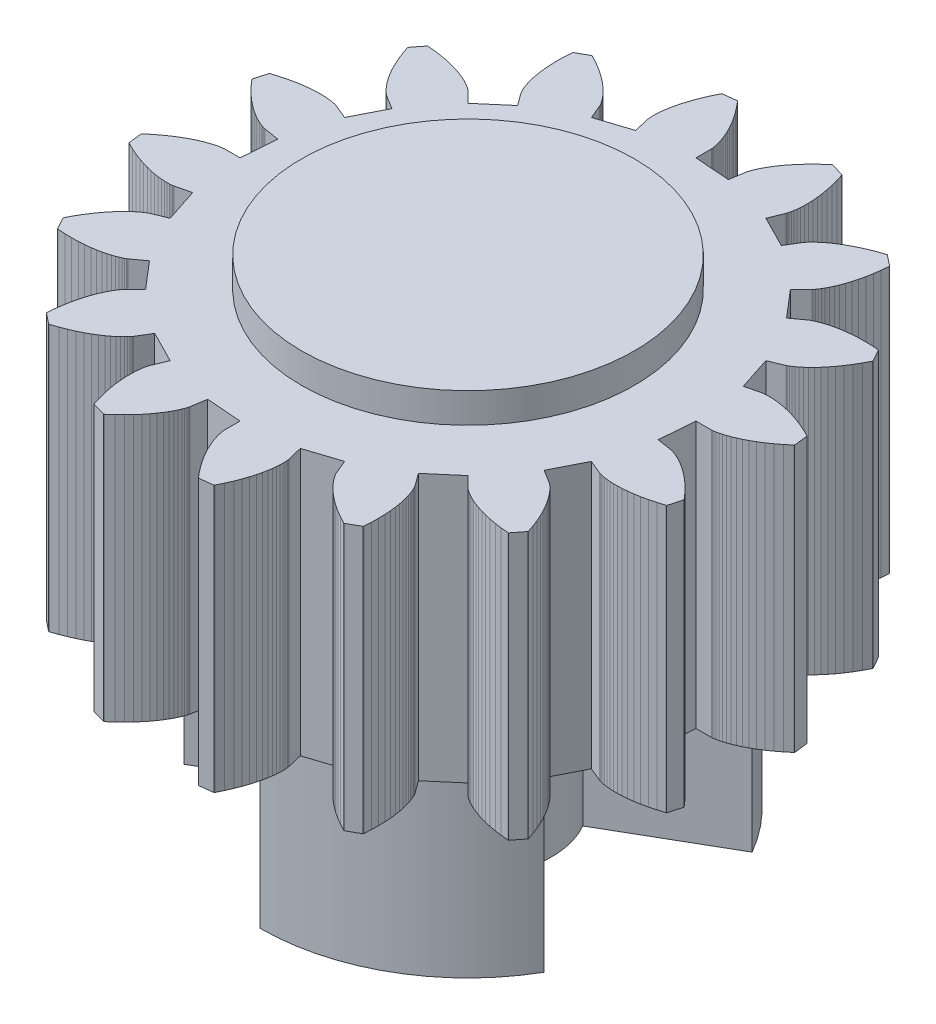
from build123d import *

# Parameters (mm, degrees)
BOSS_EXTRUDE1_DEPTH     = 8
CUT_EXTRUDE1_DEPTH      = 15.984044596
CUT_EXTRUDE1_DEPTH_BACK = 15.984044596
SKETCH2_R               = 2.525
SKETCH3_R               = 6.25
SKETCH3_R_2             = 2.525
BOSS_EXTRUDE2_DEPTH     = 5.5
SKETCH4_R               = 5
SKETCH4_R_2             = 2.5
BOSS_EXTRUDE3_DEPTH     = 0.9
CUT_EXTRUDE2_START      = -5.5
CUT_EXTRUDE2_DEPTH      = 5.5
BOSS_EXTRUDE4_START     = -14.4
SKETCH6_R               = 2.5
BOSS_EXTRUDE4_DEPTH     = 14.4
BOSS_EXTRUDE5_START     = -14.4
SKETCH7_R               = 2.525
BOSS_EXTRUDE5_DEPTH     = 14.4


with BuildPart() as part:
    # Sketch1 → Boss-Extrude1 (new body)
    with BuildSketch(Plane(origin=(0, 0, 0), x_dir=(1, 0, 0), z_dir=(0, 1, 0))):
        Polygon((6.85, 0), (7.309477, 1.3e-05), (7.321987, 0.000555), (7.348326, 0.002795), (7.388345, 0.007937), (7.441814, 0.017175), (7.508424, 0.03169), (7.587793, 0.052638), (7.679459, 0.081154), (7.782889, 0.118343), (7.897476, 0.165276), (8.022541, 0.222988), (8.157339, 0.29247), (8.301057, 0.37467), (8.452819, 0.470485), (8.611689, 0.580758), (8.776672, 0.706278), (8.94672, 0.847771), (8.957492, 0.857161), (8.958839, 0.858339), (8.908582, 1.279521), (8.906822, 1.280587), (8.894139, 1.28717), (8.695507, 1.384544), (8.505565, 1.467592), (8.325162, 1.537266), (8.155077, 1.594567), (7.996022, 1.640535), (7.848635, 1.676249), (7.713484, 1.702822), (7.591059, 1.721393), (7.481775, 1.733127), (7.385968, 1.739209), (7.303897, 1.740839), (7.235743, 1.739226), (7.181604, 1.735588), (7.141502, 1.731143), (7.115378, 1.727104), (7.103093, 1.724679), (6.656587, 1.616277), (6.328575, 2.621382), (6.753071, 2.797228), (6.764421, 2.802516), (6.787899, 2.814665), (6.822904, 2.83473), (6.868766, 2.863727), (6.924752, 2.902627), (6.990063, 2.952354), (7.063839, 3.013779), (7.145164, 3.087718), (7.233068, 3.174929), (7.326528, 3.276108), (7.424475, 3.391886), (7.525796, 3.522827), (7.62934, 3.669425), (7.733916, 3.832101), (7.838307, 4.011203), (7.941264, 4.207), (7.947622, 4.219797), (7.948416, 4.221401), (7.740805, 4.59129), (7.738771, 4.591601), (7.724535, 4.592829), (7.503759, 4.606779), (7.296494, 4.610817), (7.10316, 4.60615), (6.924094, 4.594), (6.759555, 4.575601), (6.609721, 4.552195), (6.474689, 4.525025), (6.354476, 4.495332), (6.249019, 4.464352), (6.158178, 4.433307), (6.081731, 4.403406), (6.019382, 4.375835), (5.970756, 4.351756), (5.935408, 4.332302), (5.912818, 4.318573), (5.902396, 4.311632), (5.531362, 4.040611), (4.843681, 4.843681), (5.168571, 5.16859), (5.177034, 5.177819), (5.194075, 5.198027), (5.218737, 5.229961), (5.250012, 5.274302), (5.28685, 5.331666), (5.328159, 5.402601), (5.372813, 5.487583), (5.419653, 5.587015), (5.467491, 5.701227), (5.515117, 5.83047), (5.561302, 5.974917), (5.604802, 6.134665), (5.644363, 6.309728), (5.678725, 6.500042), (5.70663, 6.705458), (5.726822, 6.925752), (5.727799, 6.940007), (5.727919, 6.941793), (5.394561, 7.204076), (5.392562, 7.203586), (5.37894, 7.199273), (5.169631, 7.127673), (4.976599, 7.052087), (4.799767, 6.973789), (4.638981, 6.894039), (4.494008, 6.814074), (4.364536, 6.735111), (4.25018, 6.658334), (4.150481, 6.584898), (4.064908, 6.51592), (3.992861, 6.452475), (3.933677, 6.395594), (3.886624, 6.346262), (3.850915, 6.305407), (3.825702, 6.273907), (3.810085, 6.252579), (3.803113, 6.242178), (3.564037, 5.849798), (2.621382, 6.328575), (2.797204, 6.753081), (2.80149, 6.764846), (2.809501, 6.790038), (2.820065, 6.828978), (2.831991, 6.881912), (2.844072, 6.949007), (2.855091, 7.03035), (2.863825, 7.125952), (2.869048, 7.23574), (2.869538, 7.359565), (2.864079, 7.497195), (2.851471, 7.648322), (2.830527, 7.812556), (2.800083, 7.989433), (2.759, 8.17841), (2.706171, 8.378869), (2.640523, 8.59012), (2.63597, 8.603664), (2.635398, 8.60536), (2.227044, 8.720108), (2.225385, 8.71889), (2.21445, 8.709692), (2.048474, 8.563443), (1.899061, 8.419741), (1.765653, 8.279733), (1.647625, 8.144523), (1.544288, 8.015166), (1.45489, 7.892666), (1.37862, 7.777972), (1.314613, 7.671973), (1.261951, 7.575498), (1.219668, 7.489311), (1.186755, 7.414112), (1.162163, 7.350528), (1.144806, 7.299118), (1.133567, 7.260367), (1.127301, 7.234686), (1.12484, 7.222408), (1.054121, 6.768407), (0, 6.85), (-1.3e-05, 7.309477), (-0.000555, 7.321987), (-0.002795, 7.348326), (-0.007937, 7.388345), (-0.017175, 7.441814), (-0.03169, 7.508424), (-0.052638, 7.587793), (-0.081154, 7.679459), (-0.118343, 7.782889), (-0.165276, 7.897476), (-0.222988, 8.022541), (-0.29247, 8.157339), (-0.37467, 8.301057), (-0.470485, 8.452819), (-0.580758, 8.611689), (-0.706278, 8.776672), (-0.847771, 8.94672), (-0.857161, 8.957492), (-0.858339, 8.958839), (-1.279521, 8.908582), (-1.280587, 8.906822), (-1.28717, 8.894139), (-1.384544, 8.695507), (-1.467592, 8.505565), (-1.537266, 8.325162), (-1.594567, 8.155077), (-1.640535, 7.996022), (-1.676249, 7.848635), (-1.702822, 7.713484), (-1.721393, 7.591059), (-1.733127, 7.481775), (-1.739209, 7.385968), (-1.740839, 7.303897), (-1.739226, 7.235743), (-1.735588, 7.181604), (-1.731143, 7.141502), (-1.727104, 7.115378), (-1.724679, 7.103093), (-1.616277, 6.656587), (-2.621382, 6.328575), (-2.797228, 6.753071), (-2.802516, 6.764421), (-2.814665, 6.787899), (-2.83473, 6.822904), (-2.863727, 6.868766), (-2.902627, 6.924752), (-2.952354, 6.990063), (-3.013779, 7.063839), (-3.087718, 7.145164), (-3.174929, 7.233068), (-3.276108, 7.326528), (-3.391886, 7.424475), (-3.522827, 7.525796), (-3.669425, 7.62934), (-3.832101, 7.733916), (-4.011203, 7.838307), (-4.207, 7.941264), (-4.219797, 7.947622), (-4.221401, 7.948416), (-4.59129, 7.740805), (-4.591601, 7.738771), (-4.592829, 7.724535), (-4.606779, 7.503759), (-4.610817, 7.296494), (-4.60615, 7.10316), (-4.594, 6.924094), (-4.575601, 6.759555), (-4.552195, 6.609721), (-4.525025, 6.474689), (-4.495332, 6.354476), (-4.464352, 6.249019), (-4.433307, 6.158178), (-4.403406, 6.081731), (-4.375835, 6.019382), (-4.351756, 5.970756), (-4.332302, 5.935408), (-4.318573, 5.912818), (-4.311632, 5.902396), (-4.040611, 5.531362), (-4.843681, 4.843681), (-5.16859, 5.168571), (-5.177819, 5.177034), (-5.198027, 5.194075), (-5.229961, 5.218737), (-5.274302, 5.250012), (-5.331666, 5.28685), (-5.402601, 5.328159), (-5.487583, 5.372813), (-5.587015, 5.419653), (-5.701227, 5.467491), (-5.83047, 5.515117), (-5.974917, 5.561302), (-6.134665, 5.604802), (-6.309728, 5.644363), (-6.500042, 5.678725), (-6.705458, 5.70663), (-6.925752, 5.726822), (-6.940007, 5.727799), (-6.941793, 5.727919), (-7.204076, 5.394561), (-7.203586, 5.392562), (-7.199273, 5.37894), (-7.127673, 5.169631), (-7.052087, 4.976599), (-6.973789, 4.799767), (-6.894039, 4.638981), (-6.814074, 4.494008), (-6.735111, 4.364536), (-6.658334, 4.25018), (-6.584898, 4.150481), (-6.51592, 4.064908), (-6.452475, 3.992861), (-6.395594, 3.933677), (-6.346262, 3.886624), (-6.305407, 3.850915), (-6.273907, 3.825702), (-6.252579, 3.810085), (-6.242178, 3.803113), (-5.849798, 3.564037), (-6.328575, 2.621382), (-6.753081, 2.797204), (-6.764846, 2.80149), (-6.790038, 2.809501), (-6.828978, 2.820065), (-6.881912, 2.831991), (-6.949007, 2.844072), (-7.03035, 2.855091), (-7.125952, 2.863825), (-7.23574, 2.869048), (-7.359565, 2.869538), (-7.497195, 2.864079), (-7.648322, 2.851471), (-7.812556, 2.830527), (-7.989433, 2.800083), (-8.17841, 2.759), (-8.378869, 2.706171), (-8.59012, 2.640523), (-8.603664, 2.63597), (-8.60536, 2.635398), (-8.720108, 2.227044), (-8.71889, 2.225385), (-8.709692, 2.21445), (-8.563443, 2.048474), (-8.419741, 1.899061), (-8.279733, 1.765653), (-8.144523, 1.647625), (-8.015166, 1.544288), (-7.892666, 1.45489), (-7.777972, 1.37862), (-7.671973, 1.314613), (-7.575498, 1.261951), (-7.489311, 1.219668), (-7.414112, 1.186755), (-7.350528, 1.162163), (-7.299118, 1.144806), (-7.260367, 1.133567), (-7.234686, 1.127301), (-7.222408, 1.12484), (-6.768407, 1.054121), (-6.85, 0), (-7.309477, -1.3e-05), (-7.321987, -0.000555), (-7.348326, -0.002795), (-7.388345, -0.007937), (-7.441814, -0.017175), (-7.508424, -0.03169), (-7.587793, -0.052638), (-7.679459, -0.081154), (-7.782889, -0.118343), (-7.897476, -0.165276), (-8.022541, -0.222988), (-8.157339, -0.29247), (-8.301057, -0.37467), (-8.452819, -0.470485), (-8.611689, -0.580758), (-8.776672, -0.706278), (-8.94672, -0.847771), (-8.957492, -0.857161), (-8.958839, -0.858339), (-8.908582, -1.279521), (-8.906822, -1.280587), (-8.894139, -1.28717), (-8.695507, -1.384544), (-8.505565, -1.467592), (-8.325162, -1.537266), (-8.155077, -1.594567), (-7.996022, -1.640535), (-7.848635, -1.676249), (-7.713484, -1.702822), (-7.591059, -1.721393), (-7.481775, -1.733127), (-7.385968, -1.739209), (-7.303897, -1.740839), (-7.235743, -1.739226), (-7.181604, -1.735588), (-7.141502, -1.731143), (-7.115378, -1.727104), (-7.103093, -1.724679), (-6.656587, -1.616277), (-6.328575, -2.621382), (-6.753071, -2.797228), (-6.764421, -2.802516), (-6.787899, -2.814665), (-6.822904, -2.83473), (-6.868766, -2.863727), (-6.924752, -2.902627), (-6.990063, -2.952354), (-7.063839, -3.013779), (-7.145164, -3.087718), (-7.233068, -3.174929), (-7.326528, -3.276108), (-7.424475, -3.391886), (-7.525796, -3.522827), (-7.62934, -3.669425), (-7.733916, -3.832101), (-7.838307, -4.011203), (-7.941264, -4.207), (-7.947622, -4.219797), (-7.948416, -4.221401), (-7.740805, -4.59129), (-7.738771, -4.591601), (-7.724535, -4.592829), (-7.503759, -4.606779), (-7.296494, -4.610817), (-7.10316, -4.60615), (-6.924094, -4.594), (-6.759555, -4.575601), (-6.609721, -4.552195), (-6.474689, -4.525025), (-6.354476, -4.495332), (-6.249019, -4.464352), (-6.158178, -4.433307), (-6.081731, -4.403406), (-6.019382, -4.375835), (-5.970756, -4.351756), (-5.935408, -4.332302), (-5.912818, -4.318573), (-5.902396, -4.311632), (-5.531362, -4.040611), (-4.843681, -4.843681), (-5.168571, -5.16859), (-5.177034, -5.177819), (-5.194075, -5.198027), (-5.218737, -5.229961), (-5.250012, -5.274302), (-5.28685, -5.331666), (-5.328159, -5.402601), (-5.372813, -5.487583), (-5.419653, -5.587015), (-5.467491, -5.701227), (-5.515117, -5.83047), (-5.561302, -5.974917), (-5.604802, -6.134665), (-5.644363, -6.309728), (-5.678725, -6.500042), (-5.70663, -6.705458), (-5.726822, -6.925752), (-5.727799, -6.940007), (-5.727919, -6.941793), (-5.394561, -7.204076), (-5.392562, -7.203586), (-5.37894, -7.199273), (-5.169631, -7.127673), (-4.976599, -7.052087), (-4.799767, -6.973789), (-4.638981, -6.894039), (-4.494008, -6.814074), (-4.364536, -6.735111), (-4.25018, -6.658334), (-4.150481, -6.584898), (-4.064908, -6.51592), (-3.992861, -6.452475), (-3.933677, -6.395594), (-3.886624, -6.346262), (-3.850915, -6.305407), (-3.825702, -6.273907), (-3.810085, -6.252579), (-3.803113, -6.242178), (-3.564037, -5.849798), (-2.621382, -6.328575), (-2.797204, -6.753081), (-2.80149, -6.764846), (-2.809501, -6.790038), (-2.820065, -6.828978), (-2.831991, -6.881912), (-2.844072, -6.949007), (-2.855091, -7.03035), (-2.863825, -7.125952), (-2.869048, -7.23574), (-2.869538, -7.359565), (-2.864079, -7.497195), (-2.851471, -7.648322), (-2.830527, -7.812556), (-2.800083, -7.989433), (-2.759, -8.17841), (-2.706171, -8.378869), (-2.640523, -8.59012), (-2.63597, -8.603664), (-2.635398, -8.60536), (-2.227044, -8.720108), (-2.225385, -8.71889), (-2.21445, -8.709692), (-2.048474, -8.563443), (-1.899061, -8.419741), (-1.765653, -8.279733), (-1.647625, -8.144523), (-1.544288, -8.015166), (-1.45489, -7.892666), (-1.37862, -7.777972), (-1.314613, -7.671973), (-1.261951, -7.575498), (-1.219668, -7.489311), (-1.186755, -7.414112), (-1.162163, -7.350528), (-1.144806, -7.299118), (-1.133567, -7.260367), (-1.127301, -7.234686), (-1.12484, -7.222408), (-1.054121, -6.768407), (0, -6.85), (1.3e-05, -7.309477), (0.000555, -7.321987), (0.002795, -7.348326), (0.007937, -7.388345), (0.017175, -7.441814), (0.03169, -7.508424), (0.052638, -7.587793), (0.081154, -7.679459), (0.118343, -7.782889), (0.165276, -7.897476), (0.222988, -8.022541), (0.29247, -8.157339), (0.37467, -8.301057), (0.470485, -8.452819), (0.580758, -8.611689), (0.706278, -8.776672), (0.847771, -8.94672), (0.857161, -8.957492), (0.858339, -8.958839), (1.279521, -8.908582), (1.280587, -8.906822), (1.28717, -8.894139), (1.384544, -8.695507), (1.467592, -8.505565), (1.537266, -8.325162), (1.594567, -8.155077), (1.640535, -7.996022), (1.676249, -7.848635), (1.702822, -7.713484), (1.721393, -7.591059), (1.733127, -7.481775), (1.739209, -7.385968), (1.740839, -7.303897), (1.739226, -7.235743), (1.735588, -7.181604), (1.731143, -7.141502), (1.727104, -7.115378), (1.724679, -7.103093), (1.616277, -6.656587), (2.621382, -6.328575), (2.797228, -6.753071), (2.802516, -6.764421), (2.814665, -6.787899), (2.83473, -6.822904), (2.863727, -6.868766), (2.902627, -6.924752), (2.952354, -6.990063), (3.013779, -7.063839), (3.087718, -7.145164), (3.174929, -7.233068), (3.276108, -7.326528), (3.391886, -7.424475), (3.522827, -7.525796), (3.669425, -7.62934), (3.832101, -7.733916), (4.011203, -7.838307), (4.207, -7.941264), (4.219797, -7.947622), (4.221401, -7.948416), (4.59129, -7.740805), (4.591601, -7.738771), (4.592829, -7.724535), (4.606779, -7.503759), (4.610817, -7.296494), (4.60615, -7.10316), (4.594, -6.924094), (4.575601, -6.759555), (4.552195, -6.609721), (4.525025, -6.474689), (4.495332, -6.354476), (4.464352, -6.249019), (4.433307, -6.158178), (4.403406, -6.081731), (4.375835, -6.019382), (4.351756, -5.970756), (4.332302, -5.935408), (4.318573, -5.912818), (4.311632, -5.902396), (4.040611, -5.531362), (4.843681, -4.843681), (5.16859, -5.168571), (5.177819, -5.177034), (5.198027, -5.194075), (5.229961, -5.218737), (5.274302, -5.250012), (5.331666, -5.28685), (5.402601, -5.328159), (5.487583, -5.372813), (5.587015, -5.419653), (5.701227, -5.467491), (5.83047, -5.515117), (5.974917, -5.561302), (6.134665, -5.604802), (6.309728, -5.644363), (6.500042, -5.678725), (6.705458, -5.70663), (6.925752, -5.726822), (6.940007, -5.727799), (6.941793, -5.727919), (7.204076, -5.394561), (7.203586, -5.392562), (7.199273, -5.37894), (7.127673, -5.169631), (7.052087, -4.976599), (6.973789, -4.799767), (6.894039, -4.638981), (6.814074, -4.494008), (6.735111, -4.364536), (6.658334, -4.25018), (6.584898, -4.150481), (6.51592, -4.064908), (6.452475, -3.992861), (6.395594, -3.933677), (6.346262, -3.886624), (6.305407, -3.850915), (6.273907, -3.825702), (6.252579, -3.810085), (6.242178, -3.803113), (5.849798, -3.564037), (6.328575, -2.621382), (6.753081, -2.797204), (6.764846, -2.80149), (6.790038, -2.809501), (6.828978, -2.820065), (6.881912, -2.831991), (6.949007, -2.844072), (7.03035, -2.855091), (7.125952, -2.863825), (7.23574, -2.869048), (7.359565, -2.869538), (7.497195, -2.864079), (7.648322, -2.851471), (7.812556, -2.830527), (7.989433, -2.800083), (8.17841, -2.759), (8.378869, -2.706171), (8.59012, -2.640523), (8.603664, -2.63597), (8.60536, -2.635398), (8.720108, -2.227044), (8.71889, -2.225385), (8.709692, -2.21445), (8.563443, -2.048474), (8.419741, -1.899061), (8.279733, -1.765653), (8.144523, -1.647625), (8.015166, -1.544288), (7.892666, -1.45489), (7.777972, -1.37862), (7.671973, -1.314613), (7.575498, -1.261951), (7.489311, -1.219668), (7.414112, -1.186755), (7.350528, -1.162163), (7.299118, -1.144806), (7.260367, -1.133567), (7.234686, -1.127301), (7.222408, -1.12484), (6.768407, -1.054121), align=None)
    extrude(amount=BOSS_EXTRUDE1_DEPTH)

    # Sketch2 → Cut-Extrude1 (cut, two sides: drawn at the far end of the back side and taken through both)
    with BuildSketch(Plane(origin=(0, 8, 0), x_dir=(1, 0, 0), z_dir=(0, 1, 0)).offset(-CUT_EXTRUDE1_DEPTH_BACK)):
        with Locations(Location((0, 0, 0), (0, 0, 270))):
            Circle(SKETCH2_R)
    extrude(amount=CUT_EXTRUDE1_DEPTH + CUT_EXTRUDE1_DEPTH_BACK, mode=Mode.SUBTRACT)

    # Sketch3 → Boss-Extrude2 (add)
    with BuildSketch(Plane.XZ):
        with Locations(Location((0, 0, 0), (0, 0, 90))):
            Circle(SKETCH3_R)
        with Locations(Location((0, 0, 0), (0, 0, 90))):
            Circle(SKETCH3_R_2, mode=Mode.SUBTRACT)
    extrude(amount=BOSS_EXTRUDE2_DEPTH)

    # Sketch4 → Boss-Extrude3 (add)
    with BuildSketch(Plane(origin=(0, 8, 0), x_dir=(1, 0, 0), z_dir=(0, 1, 0))):
        with Locations(Location((0, 0, 0), (0, 0, 270))):
            Circle(SKETCH4_R)
        with Locations(Location((0, 0, 0), (0, 0, 270))):
            Circle(SKETCH4_R_2, mode=Mode.SUBTRACT)
    extrude(amount=BOSS_EXTRUDE3_DEPTH)

    # Sketch5 → Cut-Extrude2 (cut)
    with BuildSketch(Plane.XZ.offset(5.5).offset(CUT_EXTRUDE2_START)):
        with BuildLine():
            Line((2.186714145, -1.2625), (5.412658774, -3.125))
            ThreePointArc((5.412658774, -3.125), (6.25, 0), (5.412658774, 3.125))
            Line((5.412658774, 3.125), (2.186714145, 1.2625))
            ThreePointArc((2.186714145, 1.2625), (2.525, 0), (2.186714145, -1.2625))
        make_face()
        with BuildLine():
            ThreePointArc((-5.412658774, -3.125), (-3.125, -5.412658774), (0, -6.25))
            Line((0, -6.25), (0, -2.525))
            ThreePointArc((0, -2.525), (-1.2625, -2.186714145), (-2.186714145, -1.2625))
            Line((-2.186714145, -1.2625), (-5.412658774, -3.125))
        make_face()
        with BuildLine():
            Line((-5.412658774, 3.125), (-2.186714145, 1.2625))
            ThreePointArc((-2.186714145, 1.2625), (-1.2625, 2.186714145), (0, 2.525))
            Line((0, 2.525), (0, 6.25))
            ThreePointArc((0, 6.25), (-3.125, 5.412658774), (-5.412658774, 3.125))
        make_face()
    extrude(amount=CUT_EXTRUDE2_DEPTH, mode=Mode.SUBTRACT)

    # Sketch6 → Boss-Extrude4 (add)
    with BuildSketch(Plane(origin=(0, 8.9, 0), x_dir=(1, 0, 0), z_dir=(0, 1, 0)).offset(BOSS_EXTRUDE4_START)):
        with Locations(Location((0, 0, 0), (0, 0, 270))):
            Circle(SKETCH6_R)
    extrude(amount=BOSS_EXTRUDE4_DEPTH)

    # Sketch7 → Boss-Extrude5 (add)
    with BuildSketch(Plane.XZ.offset(5.5).offset(BOSS_EXTRUDE5_START)):
        Circle(SKETCH7_R)
    extrude(amount=BOSS_EXTRUDE5_DEPTH)


solid = part.part
